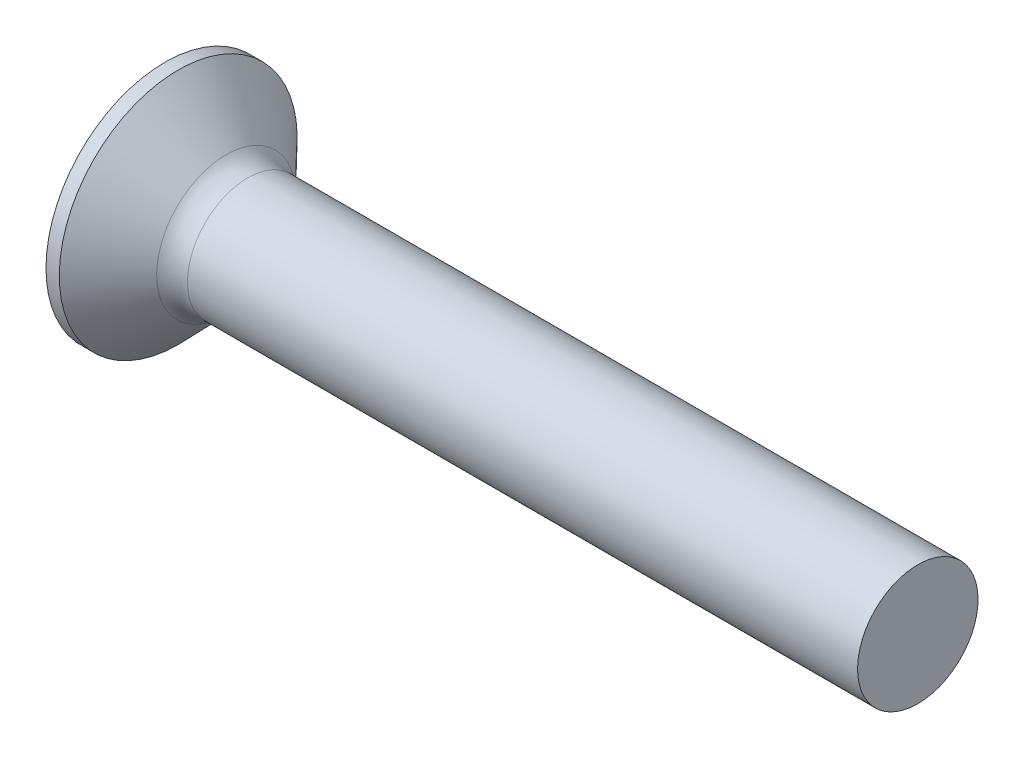
from build123d import *

# Parameters (mm, degrees)
FILLET1_R    = 2
RECPAT_COUNT = 2
RECPAT_ANGLE = 90


with BuildPart() as part:
    # BodySke → BaseBody (revolve)
    with BuildSketch(Plane.XY):
        with BuildLine():
            Line((2.01414483, 7.9), (2.897958608, 7.9))
            Line((2.897958608, 7.9), (6.66414483, 4))
            Line((6.66414483, 4), (52.01414483, 4))
            Line((52.01414483, 4), (52.01414483, 0))
            Line((52.01414483, 0), (2.01414483, 0))
            Line((2.01414483, 0), (0, 0))
            ThreePointArc((0, 0), (0.511463321, 4.076358037), (2.01414483, 7.9))
        make_face()
    revolve(axis=Axis((2.01414483, 0, 0), (1, 0, 0)))

    # Fillet1
    fillet1_edges = [part.edges().sort_by_distance(p)[0] for p in [
        (6.66414483, -4, 0),
    ]]
    fillet(fillet1_edges, radius=FILLET1_R)

    # RecSkeTop → Recess section 0
    with BuildSketch(Plane(origin=(0, 0, 0), x_dir=(0, 0, -1), z_dir=(1, 0, 0))):
        with BuildLine():
            Line((-0.946, 4.3), (0.946, 4.3))
            Line((0.946, 4.3), (0.946, -4.3))
            Line((0.946, -4.3), (-0.946, -4.3))
            Line((-0.946, -4.3), (-0.946, 4.3))
        make_face()
    # RecSkeBot → Recess section 1
    with BuildSketch(Plane(origin=(5.18, 0, 0), x_dir=(0, 0, -1), z_dir=(1, 0, 0))):
        with BuildLine():
            Line((-0.946, 1.717347702), (0.946, 1.717347702))
            Line((0.946, 1.717347702), (0.946, -1.717347702))
            Line((0.946, -1.717347702), (-0.946, -1.717347702))
            Line((-0.946, -1.717347702), (-0.946, 1.717347702))
        make_face()
    recess = loft(mode=Mode.SUBTRACT)

    # RecPat: Recess ×2 about axis
    recpat_axis = Axis((2.01414483, 0, 0), (1, 0, 0))
    for i in range(1, RECPAT_COUNT):
        add(recess.rotate(recpat_axis, i * RECPAT_ANGLE / (RECPAT_COUNT - 1)), mode=Mode.SUBTRACT)

    # RecCorSke → RecessCore (revolve, cut)
    with BuildSketch(Plane.XY):
        Polygon((0, 0), (0, 2.0812), (5.18, 1.718979114), (5.738530172, 0), align=None)
    revolve(axis=Axis((0, 0, 0), (1, 0, 0)), mode=Mode.SUBTRACT)


solid = part.part
